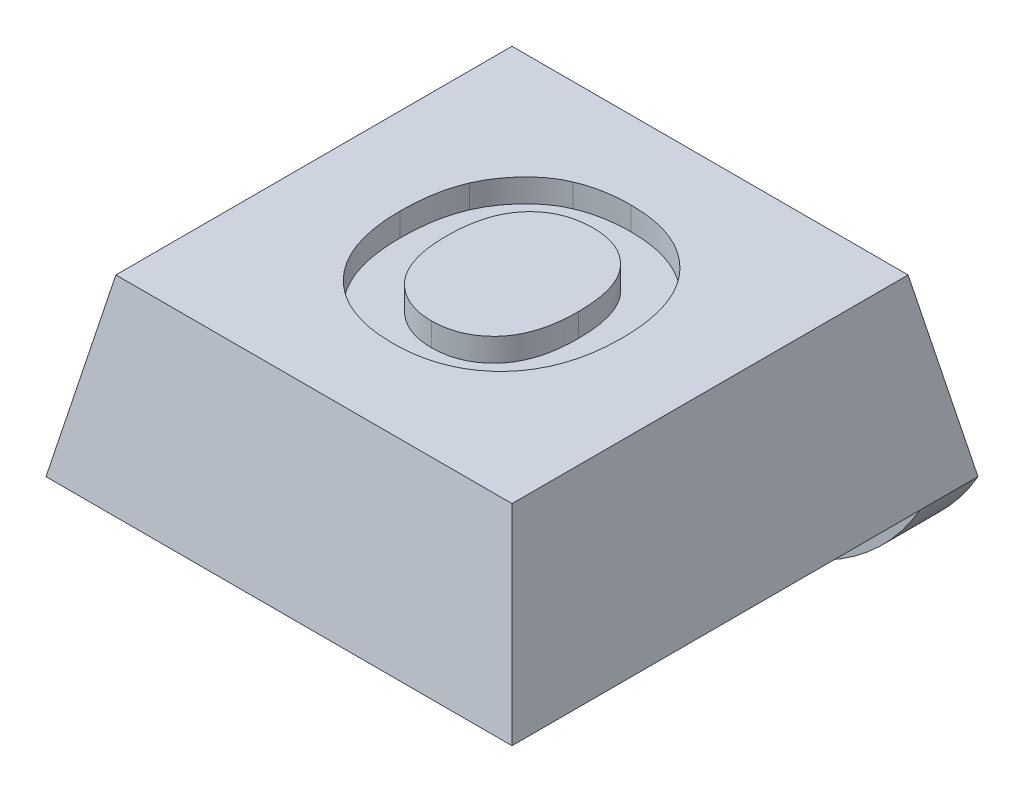
from build123d import *

# Parameters (mm, degrees)
SKETCH1_W               = 8
SKETCH1_H               = 8
BOSS_EXTRUDE1_DEPTH     = 3
CUT_EXTRUDE1_DEPTH      = 12.704699911
CUT_EXTRUDE1_DEPTH_BACK = 12.704699911
CUT_EXTRUDE2_DEPTH      = 11
SKETCH4_R               = 1.8
CUT_EXTRUDE3_DEPTH      = 0.8
SKETCH5_W               = 8
SKETCH5_H               = 1
BOSS_EXTRUDE2_DEPTH     = 2
FILLET1_R               = 4
CUT_EXTRUDE4_DEPTH      = 0.4


with BuildPart() as part:
    # Sketch1 → Boss-Extrude1 (new body)
    with BuildSketch(Plane(origin=(0, 0, 0), x_dir=(1, 0, 0), z_dir=(0, 1, 0))):
        with Locations((4, 4)):
            Rectangle(SKETCH1_W, SKETCH1_H)
    extrude(amount=BOSS_EXTRUDE1_DEPTH)

    # Sketch2 → Cut-Extrude1 (cut, two sides: drawn at the far end of the back side and taken through both)
    with BuildSketch(Plane.XY.offset(-CUT_EXTRUDE1_DEPTH_BACK)):
        Polygon((0, 0), (0.6, 3), (0, 3), align=None)
        Polygon((8, 0), (7.4, 3), (8, 3), align=None)
    extrude(amount=CUT_EXTRUDE1_DEPTH + CUT_EXTRUDE1_DEPTH_BACK, mode=Mode.SUBTRACT)

    # Sketch3 → Cut-Extrude2 (cut)
    with BuildSketch(Plane(origin=(0, 0, 0), x_dir=(0, 0, -1), z_dir=(1, 0, 0))):
        Polygon((0, 0), (0.6, 3), (0, 3), align=None)
        Polygon((8, 3), (7.4, 3), (8, 0), align=None)
    extrude(amount=CUT_EXTRUDE2_DEPTH, mode=Mode.SUBTRACT)

    # Sketch4 → Cut-Extrude3 (cut)
    with BuildSketch(Plane.XZ):
        with Locations(Location((4, -3.75, 0), (0, 0, 270))):
            Circle(SKETCH4_R)
    extrude(amount=-CUT_EXTRUDE3_DEPTH, mode=Mode.SUBTRACT)

    # Sketch5 → Boss-Extrude2 (add)
    with BuildSketch(Plane.XZ):
        with Locations((4, -7.5)):
            Rectangle(SKETCH5_W, SKETCH5_H)
    extrude(amount=BOSS_EXTRUDE2_DEPTH)

    # Fillet1
    # the kernel refuses this fillet: 4 mm, written as the material it takes off along each edge
    with BuildSketch(Plane(origin=(8, -2, -16.660254038), x_dir=(0, 1, 0), z_dir=(0, 0, 1)), Plane(origin=(0, -2, 1.660254038), x_dir=(0, 1, 0), z_dir=(0, 0, -1))) as fillet1_piece_1:
        with BuildLine():
            CenterArc((4, 3.464101615), FILLET1_R, 180, 60)
            Line((0, 3.464101615), (-0.08, 3.464101615))
            Line((-0.08, 3.464101615), (-0.08, 0))
            Line((-0.08, 0), (0, -0.08))
            ThreePointArc((0, -0.08), (1, -0.08), (1.96, -0.069282032))
            Line((1.96, -0.069282032), (2, 0))
        make_face()
    extrude(amount=18.320508076, mode=Mode.SUBTRACT)

    # Sketch6 → Cut-Extrude4 (cut)
    with BuildSketch(Plane(origin=(0, 3, 0), x_dir=(1, 0, 0), z_dir=(0, 1, 0))):
        with BuildLine():
            add(Edge.make_bspline(
                [(2.089654898, 3.986528763), (2.089937962, 4.035959112), (2.090493863, 4.133033938), (2.100126328, 4.27544635), (2.112822668, 4.411953966), (2.133498637, 4.542019848), (2.157821125, 4.666252751), (2.188242102, 4.784615798), (2.224888607, 4.896693893), (2.254041192, 4.968254545), (2.268340796, 5.003355686)],
                knots=[0, 0, 0, 0, 1.141009212, 2.240794809, 3.294380675, 4.305229195, 5.280013876, 6.216333343, 7.125095522, 8, 8, 8, 8], degree=3))
            add(Edge.make_bspline(
                [(2.268340796, 5.003355686), (2.291715222, 5.053256024), (2.338189152, 5.15246979), (2.424498545, 5.292666818), (2.522325153, 5.424883974), (2.630863596, 5.548428123), (2.747342854, 5.661439376), (2.872312421, 5.758160736), (3.001332505, 5.841858689), (3.093095075, 5.883953785), (3.138533104, 5.904797994)],
                knots=[0, 0, 0, 0, 1.031372299, 2.050613973, 3.077158538, 4.108712802, 5.127684358, 6.111366908, 7.06480644, 8, 8, 8, 8], degree=3))
            add(Edge.make_bspline(
                [(3.138533104, 5.904797994), (3.169376267, 5.917449171), (3.231718165, 5.943020427), (3.328604813, 5.974934694), (3.429167615, 6.000863593), (3.532679205, 6.024041008), (3.640144595, 6.040022598), (3.750695421, 6.053422612), (3.864936689, 6.060445793), (3.94221093, 6.06137636), (3.981481822, 6.061849276)],
                knots=[0, 0, 0, 0, 0.92659354, 1.872881803, 2.832850937, 3.813025581, 4.820167273, 5.851730198, 6.908245912, 8, 8, 8, 8], degree=3))
            add(Edge.make_bspline(
                [(3.981481822, 6.061849276), (4.051799393, 6.060086645), (4.189411847, 6.056637153), (4.390424999, 6.03172188), (4.580644474, 5.989650147), (4.759426374, 5.9288409), (4.928312103, 5.852828021), (5.085989518, 5.7585427), (5.232691986, 5.647005393), (5.368136158, 5.519745635), (5.490113336, 5.376985207), (5.596345325, 5.220057705), (5.685459602, 5.049698506), (5.758850354, 4.866377637), (5.815245616, 4.669496317), (5.855991141, 4.459610063), (5.880197281, 4.23656428), (5.883057671, 4.083544992), (5.884526693, 4.00495825)],
                knots=[0, 0, 0, 0, 1.064641025, 2.083517118, 3.061799897, 4.009540929, 4.938075217, 5.861300345, 6.78508344, 7.723570974, 8.670267188, 9.622657076, 10.586935816, 11.576069104, 12.607749008, 13.683335114, 14.81022093, 16, 16, 16, 16], degree=3))
            add(Edge.make_bspline(
                [(5.884526693, 4.00495825), (5.883091601, 3.926897736), (5.880297745, 3.774928499), (5.855639782, 3.553632965), (5.816583507, 3.345276789), (5.758823703, 3.150335932), (5.687623357, 2.967322864), (5.597592073, 2.798417418), (5.493584902, 2.641379175), (5.37178097, 2.500157102), (5.2386164, 2.372167), (5.092100017, 2.261933284), (4.935570416, 2.167520211), (4.767605484, 2.091287667), (4.589299985, 2.031730764), (4.400072033, 1.989335741), (4.199824576, 1.964516346), (4.062748303, 1.961054329), (3.99269977, 1.959285173)],
                knots=[0, 0, 0, 0, 1.18845052, 2.313691126, 3.386664782, 4.412527756, 5.405809582, 6.372003093, 7.321919452, 8.268293321, 9.206237639, 10.129603466, 11.054616372, 11.9847576, 12.932764752, 13.912672021, 14.933336461, 16, 16, 16, 16], degree=3))
            add(Edge.make_bspline(
                [(3.99269977, 1.959285173), (3.921851099, 1.961058411), (3.783179897, 1.964529147), (3.580796614, 1.989272994), (3.389690252, 2.031681973), (3.209996896, 2.091448367), (3.040491004, 2.166522847), (2.882737558, 2.259971154), (2.736649357, 2.370903), (2.60237212, 2.497386547), (2.480643503, 2.638193424), (2.376784009, 2.794221956), (2.286748029, 2.961477617), (2.215173347, 3.142493932), (2.157731606, 3.335408473), (2.118579893, 3.541331287), (2.09387425, 3.75969562), (2.091087056, 3.909535694), (2.089654898, 3.986528763)],
                knots=[0, 0, 0, 0, 1.080878253, 2.11558926, 3.1052859, 4.062802436, 5.000434901, 5.928596448, 6.853693179, 7.793554778, 8.738606028, 9.68692032, 10.647726704, 11.63151566, 12.651483354, 13.714466703, 14.825613081, 16, 16, 16, 16], degree=3))
        make_face()
        with BuildLine():
            add(Edge.make_bspline(
                [(2.858885668, 4.012971071), (2.85965412, 3.957640503), (2.861142212, 3.850493912), (2.876992368, 3.694973228), (2.901046254, 3.549583199), (2.936421027, 3.414488839), (2.98111032, 3.289592419), (3.035863968, 3.174789463), (3.100455695, 3.069908984), (3.176556171, 2.977165157), (3.258890919, 2.894362796), (3.347763935, 2.822717871), (3.441518937, 2.761052648), (3.541778172, 2.712368162), (3.646455066, 2.673731696), (3.756362885, 2.645084172), (3.872048117, 2.629353868), (3.950988508, 2.627098013), (3.991097206, 2.62595184)],
                knots=[0, 0, 0, 0, 1.313550922, 2.543666373, 3.708465049, 4.810029406, 5.85539231, 6.85404609, 7.825601258, 8.772642133, 9.696587791, 10.59409323, 11.479048685, 12.35559886, 13.234601248, 14.125357077, 15.047515647, 16, 16, 16, 16], degree=3))
            add(Edge.make_bspline(
                [(3.991097206, 2.62595184), (4.031211308, 2.62707479), (4.110162334, 2.629284937), (4.225705423, 2.645336869), (4.335831051, 2.6727565), (4.440092094, 2.711194976), (4.538963761, 2.760652512), (4.632359934, 2.820935331), (4.719742254, 2.892906209), (4.801987382, 2.974505658), (4.876033724, 3.06786548), (4.940075505, 3.17272786), (4.994802176, 3.288227099), (5.039496175, 3.414406406), (5.074000367, 3.551503186), (5.097072556, 3.699589977), (5.113050883, 3.858243352), (5.114532906, 3.967789388), (5.115295924, 4.02418902)],
                knots=[0, 0, 0, 0, 0.949153107, 1.868086493, 2.754172764, 3.630100905, 4.492260106, 5.365378617, 6.254840125, 7.166615376, 8.102436631, 9.067266169, 10.06813181, 11.121736829, 12.23011542, 13.408501285, 14.665770308, 16, 16, 16, 16], degree=3))
            add(Edge.make_bspline(
                [(5.115295924, 4.02418902), (5.114434086, 4.080044083), (5.112765054, 4.18821272), (5.098229512, 4.344863246), (5.07442298, 4.490602534), (5.041329269, 4.625392829), (4.997593851, 4.74925585), (4.945357013, 4.862530314), (4.882195257, 4.964624424), (4.809756461, 5.055485317), (4.729599598, 5.135460421), (4.643086506, 5.205475199), (4.549725647, 5.26373175), (4.45042821, 5.312746734), (4.344160403, 5.349110772), (4.232002157, 5.375634395), (4.113636071, 5.391967682), (4.032549387, 5.394095071), (3.991097206, 5.395182609)],
                knots=[0, 0, 0, 0, 1.332337092, 2.580197383, 3.749299508, 4.852775005, 5.886662144, 6.878700295, 7.822989687, 8.743523536, 9.644687758, 10.519443927, 11.392806431, 12.264866173, 13.155606721, 14.065961015, 15.011303331, 16, 16, 16, 16], degree=3))
            add(Edge.make_bspline(
                [(3.991097206, 5.395182609), (3.949639786, 5.394111799), (3.868542852, 5.392017134), (3.749992261, 5.375413426), (3.637480681, 5.349680139), (3.531227894, 5.311239711), (3.431065544, 5.262695426), (3.337364104, 5.202490837), (3.249385236, 5.13259488), (3.168510191, 5.05140717), (3.094897659, 4.95975062), (3.031705485, 4.856409024), (2.977820274, 4.742511001), (2.933610582, 4.617719403), (2.900837529, 4.481690937), (2.87564871, 4.335339795), (2.861503604, 4.177780175), (2.859777069, 4.069088169), (2.858885668, 4.012971071)],
                knots=[0, 0, 0, 0, 0.981996942, 1.920933313, 2.83127778, 3.712125466, 4.592427284, 5.463259035, 6.34592384, 7.249932058, 8.173122297, 9.125107726, 10.113123258, 11.154048744, 12.256187849, 13.424658091, 14.670364834, 16, 16, 16, 16], degree=3))
        make_face(mode=Mode.SUBTRACT)
    extrude(amount=-CUT_EXTRUDE4_DEPTH, mode=Mode.SUBTRACT)


solid = part.part
